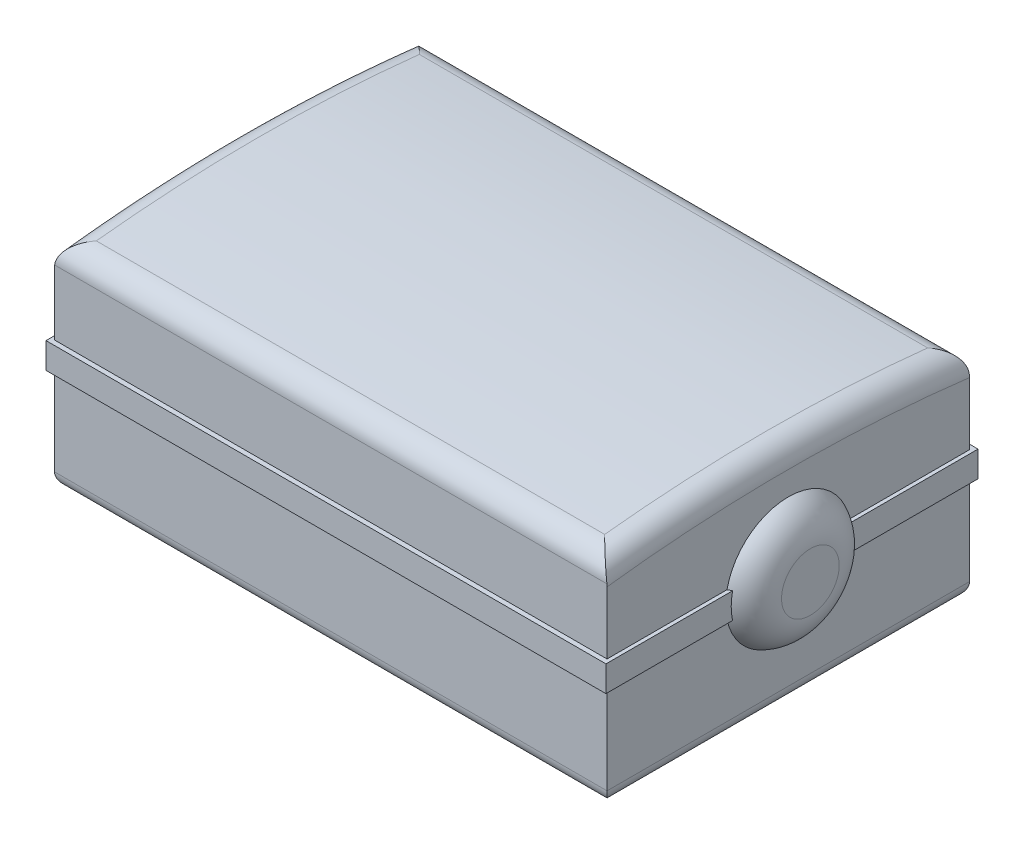
from build123d import *

# Parameters (mm, degrees)
EXTRUDE_1_DEPTH      = 37.5
EXTRUDE_1_DEPTH_BACK = 37.5
SKETCH_2_R           = 8.5
EXTRUDE_3_DEPTH      = 3
FILLET_1_R           = 5
SKETCH_3_W           = 50.5
SKETCH_3_H           = 3.5
EXTRUDE_4_DEPTH      = 0.5
FILLET_2_R           = 3
FILLET_3_R           = 2


with BuildPart() as part:
    # 草图1 → 凸台-拉伸1 (new, two sides: drawn at the far end of the back side and taken through both)
    with BuildSketch(Plane(origin=(0, 0, 0), x_dir=(0, 0, -1), z_dir=(1, 0, 0)).offset(-EXTRUDE_1_DEPTH_BACK)):
        with BuildLine():
            Line((-24.6, 0), (24.6, 0))
            Line((24.6, 0), (24.6, 14))
            Line((24.6, 14), (25.25, 14))
            Line((25.25, 14), (25.25, 17.5))
            Line((25.25, 17.5), (24.6, 17.5))
            Line((24.6, 17.5), (24.6, 29))
            ThreePointArc((24.6, 29), (0, 30.48379885), (-24.6, 29))
            Line((-24.6, 29), (-24.6, 17.5))
            Line((-24.6, 17.5), (-25.25, 17.5))
            Line((-25.25, 17.5), (-25.25, 14))
            Line((-25.25, 14), (-24.6, 14))
            Line((-24.6, 14), (-24.6, 0))
        make_face()
    extrude(amount=EXTRUDE_1_DEPTH + EXTRUDE_1_DEPTH_BACK)

    # 草图2 → 凸台-拉伸3 (add)
    with BuildSketch(Plane.ZY.offset(37.5)):
        with Locations(Location((0, 15.75, 0), (0, 0, 180))):
            Circle(SKETCH_2_R)
    extrude_3 = extrude(amount=EXTRUDE_3_DEPTH)

    # 镜向1: 凸台-拉伸3 across plane
    add(extrude_3.mirror(Plane(origin=(0, 0, 0), x_dir=(0, 0, 1), z_dir=(1, 0, 0))))

    # 圆角1
    # the kernel refuses this fillet: 5 mm, written as the material it takes off along each edge
    with BuildSketch(Plane(origin=(-40.5, 15.75, 0), x_dir=(0, 0, -1), z_dir=(0, 1, 0))) as fillet_1_piece_1:
        with BuildLine():
            CenterArc((3.917424305, -5), FILLET_1_R, 23.578178478, 66.421821522)
            Line((3.917424305, 0), (3.917424305, 0.1))
            Line((3.917424305, 0.1), (8.5, 0.1))
            Line((8.5, 0.1), (8.6, 0))
            ThreePointArc((8.6, 0), (8.6, -1.5), (8.591651514, -2.96))
            Line((8.591651514, -2.96), (8.5, -3))
        make_face()
    revolve(axis=Axis((-40.5, 15.75, 0), (-1, 0, 0)), mode=Mode.SUBTRACT)
    with BuildSketch(Plane(origin=(40.5, 15.75, 0), x_dir=(0, 0, -1), z_dir=(0, 1, 0))) as fillet_1_piece_2:
        with BuildLine():
            CenterArc((3.917424305, 5), FILLET_1_R, 270, 66.421821522)
            Line((3.917424305, 0), (3.917424305, -0.1))
            Line((3.917424305, -0.1), (8.5, -0.1))
            Line((8.5, -0.1), (8.6, 0))
            ThreePointArc((8.6, 0), (8.6, 1.5), (8.591651514, 2.96))
            Line((8.591651514, 2.96), (8.5, 3))
        make_face()
    revolve(axis=Axis((40.5, 15.75, 0), (-1, 0, 0)), mode=Mode.SUBTRACT)

    # 草图3 → 凸台-拉伸4 (add)
    with BuildSketch(Plane(origin=(37.5, 0, 0), x_dir=(0, 0, -1), z_dir=(1, 0, 0))):
        with Locations((0, 15.75)):
            Rectangle(SKETCH_3_W, SKETCH_3_H)
    extrude_4 = extrude(amount=EXTRUDE_4_DEPTH)

    # 镜向2: 凸台-拉伸4 across plane
    add(extrude_4.mirror(Plane(origin=(0, 0, 0), x_dir=(0, 0, 1), z_dir=(1, 0, 0))))

    # 圆角2
    fillet_2_edges = [part.edges().sort_by_distance(p)[0] for p in [
        (-37.5, 30.48379885, 0),
        (0, 29, 24.6),
        (0, 29, -24.6),
        (37.5, 30.48379885, 0),
    ]]
    fillet(fillet_2_edges, radius=FILLET_2_R)

    # 圆角3
    fillet_3_edges = [part.edges().sort_by_distance(p)[0] for p in [
        (0, 0, -24.6),
        (0, 0, 24.6),
        (37.5, 0, 0),
        (-37.5, 0, 0),
    ]]
    fillet(fillet_3_edges, radius=FILLET_3_R)


solid = part.part
